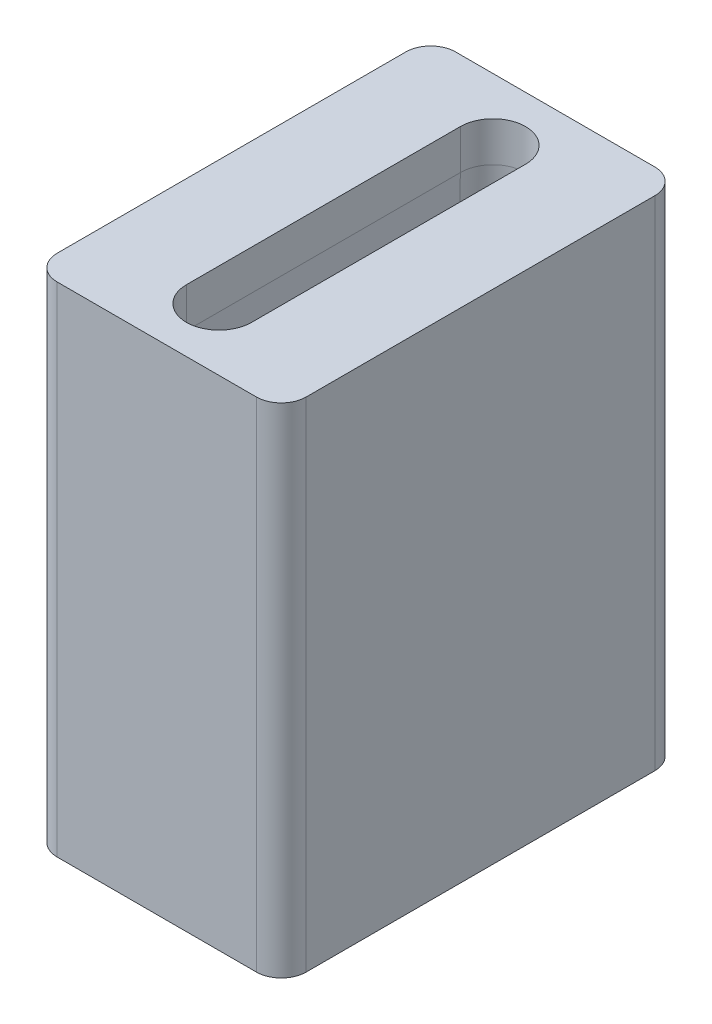
from build123d import *

# Parameters (mm, degrees)
BOSS_EXTRUDE1_DEPTH         = 40
CUT_EXTRUDE2_REACH          = 46.227
M3_TAPPED_HOLE1_D           = 2.5
M3_TAPPED_HOLE1_DEPTH       = 8.5
M3_TAPPED_HOLE1_CSINK_D     = 3.05
M3_TAPPED_HOLE1_CSINK_ANGLE = 90
M3_TAPPED_HOLE1_TIP         = 0.751075774


with BuildPart() as part:
    # Sketch1 → Boss-Extrude1 (new body)
    with BuildSketch(Plane(origin=(0, 0, 0), x_dir=(1, 0, 0), z_dir=(0, 1, 0))):
        with BuildLine():
            Line((-8, -16), (8, -16))
            ThreePointArc((8, -16), (9.414213562, -15.414213562), (10, -14))
            Line((10, -14), (10, 14))
            ThreePointArc((10, 14), (9.414213562, 15.414213562), (8, 16))
            Line((8, 16), (-8, 16))
            ThreePointArc((-8, 16), (-9.414213562, 15.414213562), (-10, 14))
            Line((-10, 14), (-10, -14))
            ThreePointArc((-10, -14), (-9.414213562, -15.414213562), (-8, -16))
        make_face()
    extrude(amount=-BOSS_EXTRUDE1_DEPTH)

    # Sketch5 → Cut-Extrude2 (cut, up to next)
    with BuildSketch(Plane(origin=(0, 0, 0), x_dir=(1, 0, 0), z_dir=(0, 1, 0)), mode=Mode.PRIVATE) as cut_extrude2_sk1:
        with BuildLine():
            Line((-2.62, -11), (-2.62, 11))
            ThreePointArc((-2.62, 11), (0, 13.62), (2.62, 11))
            Line((2.62, 11), (2.62, -11))
            ThreePointArc((2.62, -11), (0, -13.62), (-2.62, -11))
        make_face()
    cut_extrude2_tool1 = extrude(cut_extrude2_sk1.sketch, amount=-CUT_EXTRUDE2_REACH, mode=Mode.PRIVATE) & part.part
    add(cut_extrude2_tool1.solids().sort_by_distance((0, 0, 0))[0], mode=Mode.SUBTRACT)

    # Cut-Sweep1: sweep along a path in Sketch8
    with BuildLine(Plane(origin=(0, 0, 0), x_dir=(1, 0, 0), z_dir=(0, 1, 0))) as cut_sweep1_path:
        Line((-2.62, 11), (-2.62, -11))
        ThreePointArc((-2.62, -11), (0, -13.62), (2.62, -11))
        Line((2.62, -11), (2.62, 11))
        ThreePointArc((2.62, 11), (0, 13.62), (-2.62, 11))
    # Sketch7 → Cut-Sweep1 (sweep, cut)
    with BuildSketch(Plane.XY):
        Polygon((2.62, -3.2), (3.262346389, -40), (2.62, -40), align=None)
    sweep(path=cut_sweep1_path.line, mode=Mode.SUBTRACT)

    # M3 Tapped Hole1
    with Locations(Plane(origin=(0, -40, 0), x_dir=(-1, 0, 0), z_dir=(0, -1, 0))):
        with Locations((-7, 13), (7, -13)):
            CounterSinkHole(M3_TAPPED_HOLE1_D / 2, M3_TAPPED_HOLE1_CSINK_D / 2, depth=M3_TAPPED_HOLE1_DEPTH, counter_sink_angle=M3_TAPPED_HOLE1_CSINK_ANGLE)
            with Locations((0, 0, -(M3_TAPPED_HOLE1_DEPTH + M3_TAPPED_HOLE1_TIP / 2))):  # 118° drill point
                Cone(0, M3_TAPPED_HOLE1_D / 2, M3_TAPPED_HOLE1_TIP, mode=Mode.SUBTRACT)


solid = part.part
